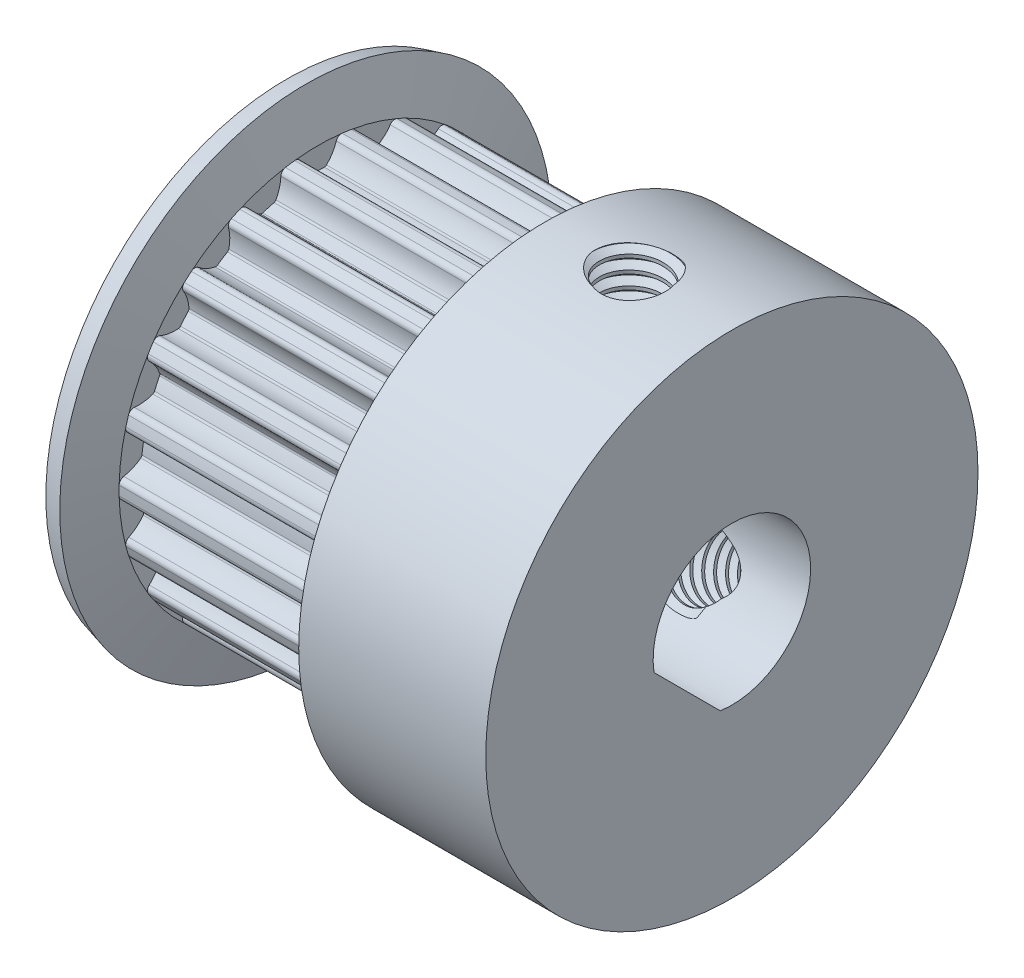
from build123d import *

# Parameters (mm, degrees)
BOSS_EXTRUDE4_DEPTH      = 11
SKETCH21_R               = 12.5
BOSS_EXTRUDE5_DEPTH      = 10
SKETCH22_R               = 8
BOSS_EXTRUDE6_DEPTH      = 1
F_8_0_8_DIAMETER_HOLE2_D = 8
SKETCH25_W               = 1.621
SKETCH25_H               = 13.418493926
SKETCH27_W               = 1.621
SKETCH27_H               = 8.843176378
CHAMFER2_SIZE            = 2
CHAMFER2_SIZE2           = 0.5
FILLET3_R                = 0.15
FILLET4_R                = 0.28
THREAD1_PITCH            = 0.7
THREAD2_PITCH            = 0.7
BOSS_EXTRUDE7_DEPTH      = 23


with BuildPart() as part:
    # Sketch12 → Revolve1 (revolve)
    with BuildSketch(Plane.XY, mode=Mode.PRIVATE) as revolve1_sk:
        Polygon((1, 9.993347502), (1, 0), (2, 0), (2, 10.125), (1.363620668, 12.5), (0.397694842, 12.241180955), align=None)
    revolve(revolve1_sk.sketch.rotate(Axis((0.397694842, 0, 0), (1, 0, 0)), 270), axis=Axis((0.397694842, 0, 0), (1, 0, 0)))

    # Sketch16 → Boss-Extrude4 (add)
    with BuildSketch(Plane(origin=(2, 0, 0), x_dir=(0, 0, -1), z_dir=(1, 0, 0))):
        with BuildLine():
            ThreePointArc((0.962989423, 10.07910097), (1.440937738, 10.021942099), (1.915629302, 9.942132034))
            ThreePointArc((1.915629302, 9.942132034), (1.956814924, 9.321945766), (2.188708301, 8.745271921))
            ThreePointArc((2.188708301, 8.745271921), (2.539819, 8.649829157), (2.88679237, 8.540295944))
            ThreePointArc((2.88679237, 8.540295944), (3.393646912, 8.900053828), (3.763592472, 9.399521089))
            ThreePointArc((3.763592472, 9.399521089), (4.206077007, 9.210023953), (4.639055134, 8.999710688))
            ThreePointArc((4.639055134, 8.999710688), (4.503845785, 8.393042991), (4.563878055, 7.774396575))
            ThreePointArc((4.563878055, 7.774396575), (4.873876969, 7.583900598), (5.175936407, 7.381050556))
            ThreePointArc((5.175936407, 7.381050556), (5.763615288, 7.583438292), (6.259291642, 7.958447911))
            ThreePointArc((6.259291642, 7.958447911), (6.630464931, 7.65196444), (6.986652308, 7.328186305))
            ThreePointArc((6.986652308, 7.328186305), (6.686001847, 6.784185789), (6.569309551, 6.173685854))
            ThreePointArc((6.569309551, 6.173685854), (6.813082413, 5.903569517), (7.04575686, 5.623836348))
            ThreePointArc((7.04575686, 5.623836348), (7.666649831, 5.652457685), (8.247900228, 5.872628613))
            ThreePointArc((8.247900228, 5.872628613), (8.51769202, 5.473988277), (8.768232464, 5.062975851))
            ThreePointArc((8.768232464, 5.062975851), (8.326497802, 4.625714201), (8.042534656, 4.072819822))
            ThreePointArc((8.042534656, 4.072819822), (8.200332438, 3.744966342), (8.344771995, 3.411012366))
            ThreePointArc((8.344771995, 3.411012366), (8.948578, 3.263548573), (9.568312991, 3.311043871))
            ThreePointArc((9.568312991, 3.311043871), (9.714866358, 2.852542138), (9.839462571, 2.387593203))
            ThreePointArc((9.839462571, 2.387593203), (9.292430425, 2.092494758), (8.864201435, 1.64199815))
            ThreePointArc((8.864201435, 1.64199815), (8.923240299, 1.282968267), (8.96774333, 0.921848447))
            ThreePointArc((8.96774333, 0.921848447), (9.505545599, 0.610246165), (10.113557939, 0.481218046))
            ThreePointArc((10.113557939, 0.481218046), (10.125, 0), (10.113557939, -0.481218046))
            ThreePointArc((10.113557939, -0.481218046), (9.505545599, -0.610246165), (8.96774333, -0.921848447))
            ThreePointArc((8.96774333, -0.921848447), (8.923240299, -1.282968267), (8.864201435, -1.64199815))
            ThreePointArc((8.864201435, -1.64199815), (9.292430425, -2.092494758), (9.839462571, -2.387593203))
            ThreePointArc((9.839462571, -2.387593203), (9.714866358, -2.852542138), (9.568312991, -3.311043871))
            ThreePointArc((9.568312991, -3.311043871), (8.948578, -3.263548573), (8.344771995, -3.411012366))
            ThreePointArc((8.344771995, -3.411012366), (8.200332438, -3.744966342), (8.042534656, -4.072819822))
            ThreePointArc((8.042534656, -4.072819822), (8.326497802, -4.625714201), (8.768232464, -5.062975851))
            ThreePointArc((8.768232464, -5.062975851), (8.51769202, -5.473988277), (8.247900228, -5.872628613))
            ThreePointArc((8.247900228, -5.872628613), (7.666649831, -5.652457685), (7.04575686, -5.623836348))
            ThreePointArc((7.04575686, -5.623836348), (6.813082413, -5.903569517), (6.569309551, -6.173685854))
            ThreePointArc((6.569309551, -6.173685854), (6.686001847, -6.784185789), (6.986652308, -7.328186305))
            ThreePointArc((6.986652308, -7.328186305), (6.630464931, -7.65196444), (6.259291642, -7.958447911))
            ThreePointArc((6.259291642, -7.958447911), (5.763615288, -7.583438292), (5.175936407, -7.381050556))
            ThreePointArc((5.175936407, -7.381050556), (4.873876969, -7.583900598), (4.563878055, -7.774396575))
            ThreePointArc((4.563878055, -7.774396575), (4.503845785, -8.393042991), (4.639055134, -8.999710688))
            ThreePointArc((4.639055134, -8.999710688), (4.206077007, -9.210023953), (3.763592472, -9.399521089))
            ThreePointArc((3.763592472, -9.399521089), (3.393646912, -8.900053828), (2.88679237, -8.540295944))
            ThreePointArc((2.88679237, -8.540295944), (2.539819, -8.649829157), (2.188708301, -8.745271921))
            ThreePointArc((2.188708301, -8.745271921), (1.956814924, -9.321945766), (1.915629302, -9.942132034))
            ThreePointArc((1.915629302, -9.942132034), (1.440937738, -10.021942099), (0.962989423, -10.07910097))
            ThreePointArc((0.962989423, -10.07910097), (0.748745446, -9.495639935), (0.363777582, -9.007657346))
            ThreePointArc((0.363777582, -9.007657346), (0, -9.015), (-0.363777582, -9.007657346))
            ThreePointArc((-0.363777582, -9.007657346), (-0.748745446, -9.495639935), (-0.962989423, -10.07910097))
            ThreePointArc((-0.962989423, -10.07910097), (-1.440937738, -10.021942099), (-1.915629302, -9.942132034))
            ThreePointArc((-1.915629302, -9.942132034), (-1.956814924, -9.321945766), (-2.188708301, -8.745271921))
            ThreePointArc((-2.188708301, -8.745271921), (-2.539819, -8.649829157), (-2.88679237, -8.540295944))
            ThreePointArc((-2.88679237, -8.540295944), (-3.393646912, -8.900053828), (-3.763592472, -9.399521089))
            ThreePointArc((-3.763592472, -9.399521089), (-4.206077007, -9.210023953), (-4.639055134, -8.999710688))
            ThreePointArc((-4.639055134, -8.999710688), (-4.503845785, -8.393042991), (-4.563878055, -7.774396575))
            ThreePointArc((-4.563878055, -7.774396575), (-4.873876969, -7.583900598), (-5.175936407, -7.381050556))
            ThreePointArc((-5.175936407, -7.381050556), (-5.763615288, -7.583438292), (-6.259291642, -7.958447911))
            ThreePointArc((-6.259291642, -7.958447911), (-6.630464931, -7.65196444), (-6.986652308, -7.328186305))
            ThreePointArc((-6.986652308, -7.328186305), (-6.686001847, -6.784185789), (-6.569309551, -6.173685854))
            ThreePointArc((-6.569309551, -6.173685854), (-6.813082413, -5.903569517), (-7.04575686, -5.623836348))
            ThreePointArc((-7.04575686, -5.623836348), (-7.666649831, -5.652457685), (-8.247900228, -5.872628613))
            ThreePointArc((-8.247900228, -5.872628613), (-8.51769202, -5.473988277), (-8.768232464, -5.062975851))
            ThreePointArc((-8.768232464, -5.062975851), (-8.326497802, -4.625714201), (-8.042534656, -4.072819822))
            ThreePointArc((-8.042534656, -4.072819822), (-8.200332438, -3.744966342), (-8.344771995, -3.411012366))
            ThreePointArc((-8.344771995, -3.411012366), (-8.948578, -3.263548573), (-9.568312991, -3.311043871))
            ThreePointArc((-9.568312991, -3.311043871), (-9.714866358, -2.852542138), (-9.839462571, -2.387593203))
            ThreePointArc((-9.839462571, -2.387593203), (-9.292430425, -2.092494758), (-8.864201435, -1.64199815))
            ThreePointArc((-8.864201435, -1.64199815), (-8.923240299, -1.282968267), (-8.96774333, -0.921848447))
            ThreePointArc((-8.96774333, -0.921848447), (-9.505545599, -0.610246165), (-10.113557939, -0.481218046))
            ThreePointArc((-10.113557939, -0.481218046), (-10.125, 0), (-10.113557939, 0.481218046))
            ThreePointArc((-10.113557939, 0.481218046), (-9.505545599, 0.610246165), (-8.96774333, 0.921848447))
            ThreePointArc((-8.96774333, 0.921848447), (-8.923240299, 1.282968267), (-8.864201435, 1.64199815))
            ThreePointArc((-8.864201435, 1.64199815), (-9.292430425, 2.092494758), (-9.839462571, 2.387593203))
            ThreePointArc((-9.839462571, 2.387593203), (-9.714866358, 2.852542138), (-9.568312991, 3.311043871))
            ThreePointArc((-9.568312991, 3.311043871), (-8.948578, 3.263548573), (-8.344771995, 3.411012366))
            ThreePointArc((-8.344771995, 3.411012366), (-8.200332438, 3.744966342), (-8.042534656, 4.072819822))
            ThreePointArc((-8.042534656, 4.072819822), (-8.326497802, 4.625714201), (-8.768232464, 5.062975851))
            ThreePointArc((-8.768232464, 5.062975851), (-8.51769202, 5.473988277), (-8.247900228, 5.872628613))
            ThreePointArc((-8.247900228, 5.872628613), (-7.666649831, 5.652457685), (-7.04575686, 5.623836348))
            ThreePointArc((-7.04575686, 5.623836348), (-6.813082413, 5.903569517), (-6.569309551, 6.173685854))
            ThreePointArc((-6.569309551, 6.173685854), (-6.686001847, 6.784185789), (-6.986652308, 7.328186305))
            ThreePointArc((-6.986652308, 7.328186305), (-6.630464931, 7.65196444), (-6.259291642, 7.958447911))
            ThreePointArc((-6.259291642, 7.958447911), (-5.763615288, 7.583438292), (-5.175936407, 7.381050556))
            ThreePointArc((-5.175936407, 7.381050556), (-4.873876969, 7.583900598), (-4.563878055, 7.774396575))
            ThreePointArc((-4.563878055, 7.774396575), (-4.503845785, 8.393042991), (-4.639055134, 8.999710688))
            ThreePointArc((-4.639055134, 8.999710688), (-4.206077007, 9.210023953), (-3.763592472, 9.399521089))
            ThreePointArc((-3.763592472, 9.399521089), (-3.393646912, 8.900053828), (-2.88679237, 8.540295944))
            ThreePointArc((-2.88679237, 8.540295944), (-2.539819, 8.649829157), (-2.188708301, 8.745271921))
            ThreePointArc((-2.188708301, 8.745271921), (-1.956814924, 9.321945766), (-1.915629302, 9.942132034))
            ThreePointArc((-1.915629302, 9.942132034), (-1.440937738, 10.021942099), (-0.962989423, 10.07910097))
            ThreePointArc((-0.962989423, 10.07910097), (-0.748745446, 9.495639935), (-0.363777582, 9.007657346))
            ThreePointArc((-0.363777582, 9.007657346), (0, 9.015), (0.363777582, 9.007657346))
            ThreePointArc((0.363777582, 9.007657346), (0.748745446, 9.495639935), (0.962989423, 10.07910097))
        make_face()
    extrude(amount=BOSS_EXTRUDE4_DEPTH)

    # Sketch21 → Boss-Extrude5 (add)
    with BuildSketch(Plane.ZY.offset(-13)):
        Circle(SKETCH21_R)
    extrude(amount=-BOSS_EXTRUDE5_DEPTH)

    # Sketch22 → Boss-Extrude6 (add)
    with BuildSketch(Plane.ZY.offset(-1)):
        Circle(SKETCH22_R)
    extrude(amount=BOSS_EXTRUDE6_DEPTH)

    # Ø8.0 (8) Diameter Hole2 (through all)
    with Locations(Plane(origin=(23, 0, 0), x_dir=(0, 0, -1), z_dir=(1, 0, 0))):
        with Locations((0, 0)):
            Hole(F_8_0_8_DIAMETER_HOLE2_D / 2)

    # Sketch25 → M3 Clearance Hole3 (revolve, cut)
    with BuildSketch(Plane(origin=(18, -1.828411811, -3.166902154), x_dir=(0, -0.8660254037844387, 0.4999999999999999), z_dir=(1, 0, 0))):
        with Locations((0.8105, 6.709246963)):
            Rectangle(SKETCH25_W, SKETCH25_H)
    revolve(axis=Axis((18, 1.346588189, 2.332359161), (0, -0.49999999999999994, -0.8660254037844388)), mode=Mode.SUBTRACT)

    # Sketch27 → M3 Clearance Hole4 (revolve, cut)
    with BuildSketch(Plane(origin=(18, 3.656823622, 0), x_dir=(0, 0, -1), z_dir=(1, 0, 0))):
        with Locations((0.8105, 4.421588189)):
            Rectangle(SKETCH27_W, SKETCH27_H)
    revolve(axis=Axis((18, -2.693176378, 0), (0, 1, 0)), mode=Mode.SUBTRACT)

    # Chamfer2
    chamfer2_edges = [part.edges().sort_by_distance(p)[0] for p in [
        (13, 0, -12.5),
    ]]
    chamfer2_side = [part.faces().sort_by_distance(p)[0] for p in [
        (13, 0, -12.146446609),
    ]]
    chamfer(chamfer2_edges, length=CHAMFER2_SIZE, length2=CHAMFER2_SIZE2, reference=chamfer2_side[0])

    # Fillet3
    fillet3_edges = [part.edges().sort_by_distance(p)[0] for p in [
        (7.5, 9.007657346, -0.363777582),
        (7.5, 9.007657346, 0.363777582),
        (7.5, 8.745271921, 2.188708301),
        (7.5, 8.540295944, 2.88679237),
        (7.5, 7.774396575, 4.563878055),
        (7.5, 7.381050556, 5.175936407),
        (7.5, 6.173685854, 6.569309551),
        (7.5, 5.623836348, 7.04575686),
        (7.5, 4.072819822, 8.042534656),
        (7.5, 3.411012366, 8.344771995),
        (7.5, 1.64199815, 8.864201435),
        (7.5, 0.921848447, 8.96774333),
        (7.5, -0.921848447, 8.96774333),
        (7.5, -1.64199815, 8.864201435),
        (7.5, -3.411012366, 8.344771995),
        (7.5, -4.072819822, 8.042534656),
        (7.5, -5.623836348, 7.04575686),
        (7.5, -6.173685854, 6.569309551),
        (7.5, -7.381050556, 5.175936407),
        (7.5, -7.774396575, 4.563878055),
        (7.5, -8.540295944, 2.88679237),
        (7.5, -8.745271921, 2.188708301),
        (7.5, -9.007657346, 0.363777582),
        (7.5, -9.007657346, -0.363777582),
        (7.5, -8.745271921, -2.188708301),
        (7.5, -8.540295944, -2.88679237),
        (7.5, -7.774396575, -4.563878055),
        (7.5, -7.381050556, -5.175936407),
        (7.5, -6.173685854, -6.569309551),
        (7.5, -5.623836348, -7.04575686),
        (7.5, -4.072819822, -8.042534656),
        (7.5, -3.411012366, -8.344771995),
        (7.5, -1.64199815, -8.864201435),
        (7.5, -0.921848447, -8.96774333),
        (7.5, 0.921848447, -8.96774333),
        (7.5, 1.64199815, -8.864201435),
        (7.5, 3.411012366, -8.344771995),
        (7.5, 4.072819822, -8.042534656),
        (7.5, 5.623836348, -7.04575686),
        (7.5, 6.173685854, -6.569309551),
        (7.5, 7.381050556, -5.175936407),
        (7.5, 7.774396575, -4.563878055),
        (7.5, 8.540295944, -2.88679237),
        (7.5, 8.745271921, -2.188708301),
    ]]
    fillet(fillet3_edges, radius=FILLET3_R)

    # Fillet4
    fillet4_edges = [part.edges().sort_by_distance(p)[0] for p in [
        (7.5, 10.07910097, -0.962989423),
        (7.5, 10.07910097, 0.962989423),
        (7.5, 9.942132034, 1.915629302),
        (7.5, 9.399521089, 3.763592472),
        (7.5, 8.999710688, 4.639055134),
        (7.5, 7.958447911, 6.259291642),
        (7.5, 7.328186305, 6.986652308),
        (7.5, 5.872628613, 8.247900228),
        (7.5, 5.062975851, 8.768232464),
        (7.5, 3.311043871, 9.568312991),
        (7.5, 2.387593203, 9.839462571),
        (7.5, 0.481218046, 10.113557939),
        (7.5, -0.481218046, 10.113557939),
        (7.5, -2.387593203, 9.839462571),
        (7.5, -3.311043871, 9.568312991),
        (7.5, -5.062975851, 8.768232464),
        (7.5, -5.872628613, 8.247900228),
        (7.5, -7.328186305, 6.986652308),
        (7.5, -7.958447911, 6.259291642),
        (7.5, -8.999710688, 4.639055134),
        (7.5, -9.399521089, 3.763592472),
        (7.5, -9.942132034, 1.915629302),
        (7.5, -10.07910097, 0.962989423),
        (7.5, -10.07910097, -0.962989423),
        (7.5, -9.942132034, -1.915629302),
        (7.5, -9.399521089, -3.763592472),
        (7.5, -8.999710688, -4.639055134),
        (7.5, -7.958447911, -6.259291642),
        (7.5, -7.328186305, -6.986652308),
        (7.5, -5.872628613, -8.247900228),
        (7.5, -5.062975851, -8.768232464),
        (7.5, -3.311043871, -9.568312991),
        (7.5, -2.387593203, -9.839462571),
        (7.5, -0.481218046, -10.113557939),
        (7.5, 0.481218046, -10.113557939),
        (7.5, 2.387593203, -9.839462571),
        (7.5, 3.311043871, -9.568312991),
        (7.5, 5.062975851, -8.768232464),
        (7.5, 5.872628613, -8.247900228),
        (7.5, 7.328186305, -6.986652308),
        (7.5, 7.958447911, -6.259291642),
        (7.5, 8.999710688, -4.639055134),
        (7.5, 9.399521089, -3.763592472),
        (7.5, 9.942132034, -1.915629302),
    ]]
    fillet(fillet4_edges, radius=FILLET4_R)

    # Thread1: the profile of Thread Profile1 profile screwed along a right-hand helix of 14.285714 turns, 6 arcs to a turn; built about Z, then put on its axis
    thread1_z = Axis((0, 0, 0), (0, 0, 1))
    thread1_corners = [(1.6207, 0, -0.000173205), (1.999886112, 0, 0.218749999), (1.999886112, 0, 0.306249999), (1.6207, 0, 0.525173203)]
    with BuildLine(mode=Mode.PRIVATE) as thread1_profile:
        Line(thread1_corners[0], thread1_corners[1])
        Line(thread1_corners[1], thread1_corners[2])
        Line(thread1_corners[2], thread1_corners[3])
        Line(thread1_corners[3], thread1_corners[0])
    thread1_cap = Face(thread1_profile.wire())
    thread1_turn_angles = [0, 30, 60, 90, 120, 150, 180, 210, 240, 270, 300, 330, 360]
    thread1_turn_weights = [1, 0.8660254037844387, 1, 0.8660254037844387, 1, 0.8660254037844387, 1, 0.8660254037844387, 1, 0.8660254037844387, 1, 0.8660254037844387, 1]
    thread1_turn_rails = [Edge.make_bspline([Vector(p[0], p[1], 0).rotate(thread1_z, thread1_turn_angles[k]) / thread1_turn_weights[k] + Vector(0, 0, p[2] + THREAD1_PITCH * thread1_turn_angles[k] / 360) for k in range(13)], [0, 0, 0, 1, 1, 2, 2, 3, 3, 4, 4, 5, 5, 6, 6, 6], 2, thread1_turn_weights) for p in thread1_corners]
    thread1_turn_sides = [Face.make_surface_from_curves(thread1_turn_rails[p[0]], thread1_turn_rails[p[1]]) for p in [(0, 1), (1, 2), (2, 3), (3, 0)]]
    thread1_last_angles = [5040, 5070, 5100, 5121.428571429, 5142.857142857]
    thread1_last_weights = [1, 0.8660254037844387, 1, 0.9308737486442035, 1]
    thread1_last_rails = [Edge.make_bspline([Vector(p[0], p[1], 0).rotate(thread1_z, thread1_last_angles[k]) / thread1_last_weights[k] + Vector(0, 0, p[2] + THREAD1_PITCH * thread1_last_angles[k] / 360) for k in range(5)], [0, 0, 0, 1, 1, 2, 2, 2], 2, thread1_last_weights) for p in thread1_corners]
    thread1_last_sides = [Face.make_surface_from_curves(thread1_last_rails[p[0]], thread1_last_rails[p[1]]) for p in [(0, 1), (1, 2), (2, 3), (3, 0)]]
    thread1 = Plane(origin=(18, 13.5, 0), x_dir=(-1, 0, 0), z_dir=(0, -1, 0)) * Solid(Shell([*[p.moved(Location((0, 0, THREAD1_PITCH * i))) for i in range(14) for p in thread1_turn_sides], *thread1_last_sides, thread1_cap, thread1_cap.rotate(thread1_z, 5142.857142857).moved(Location((0, 0, THREAD1_PITCH * 5142.857142857 / 360)))]))
    add(thread1, mode=Mode.SUBTRACT)

    # Thread2: the profile of Thread Profile2 profile screwed along a right-hand helix of 14.285714 turns, 6 arcs to a turn; built about Z, then put on its axis
    thread2_z = Axis((0, 0, 0), (0, 0, 1))
    thread2_corners = [(1.6207, 0, -0.000173205), (1.999886112, 0, 0.218749999), (1.999886112, 0, 0.306249999), (1.6207, 0, 0.525173203)]
    with BuildLine(mode=Mode.PRIVATE) as thread2_profile:
        Line(thread2_corners[0], thread2_corners[1])
        Line(thread2_corners[1], thread2_corners[2])
        Line(thread2_corners[2], thread2_corners[3])
        Line(thread2_corners[3], thread2_corners[0])
    thread2_cap = Face(thread2_profile.wire())
    thread2_turn_angles = [0, 30, 60, 90, 120, 150, 180, 210, 240, 270, 300, 330, 360]
    thread2_turn_weights = [1, 0.8660254037844387, 1, 0.8660254037844387, 1, 0.8660254037844387, 1, 0.8660254037844387, 1, 0.8660254037844387, 1, 0.8660254037844387, 1]
    thread2_turn_rails = [Edge.make_bspline([Vector(p[0], p[1], 0).rotate(thread2_z, thread2_turn_angles[k]) / thread2_turn_weights[k] + Vector(0, 0, p[2] + THREAD2_PITCH * thread2_turn_angles[k] / 360) for k in range(13)], [0, 0, 0, 1, 1, 2, 2, 3, 3, 4, 4, 5, 5, 6, 6, 6], 2, thread2_turn_weights) for p in thread2_corners]
    thread2_turn_sides = [Face.make_surface_from_curves(thread2_turn_rails[p[0]], thread2_turn_rails[p[1]]) for p in [(0, 1), (1, 2), (2, 3), (3, 0)]]
    thread2_last_angles = [5040, 5070, 5100, 5121.428571429, 5142.857142857]
    thread2_last_weights = [1, 0.8660254037844387, 1, 0.9308737486442035, 1]
    thread2_last_rails = [Edge.make_bspline([Vector(p[0], p[1], 0).rotate(thread2_z, thread2_last_angles[k]) / thread2_last_weights[k] + Vector(0, 0, p[2] + THREAD2_PITCH * thread2_last_angles[k] / 360) for k in range(5)], [0, 0, 0, 1, 1, 2, 2, 2], 2, thread2_last_weights) for p in thread2_corners]
    thread2_last_sides = [Face.make_surface_from_curves(thread2_last_rails[p[0]], thread2_last_rails[p[1]]) for p in [(0, 1), (1, 2), (2, 3), (3, 0)]]
    thread2 = Plane(origin=(18, -6.75, -11.691342951), x_dir=(1, 0, 0), z_dir=(0, 0.5, 0.866025404)) * Solid(Shell([*[p.moved(Location((0, 0, THREAD2_PITCH * i))) for i in range(14) for p in thread2_turn_sides], *thread2_last_sides, thread2_cap, thread2_cap.rotate(thread2_z, 5142.857142857).moved(Location((0, 0, THREAD2_PITCH * 5142.857142857 / 360)))]))
    add(thread2, mode=Mode.SUBTRACT)

    # Sketch35 → Boss-Extrude7 (add)
    with BuildSketch(Plane.ZY):
        with BuildLine():
            Line((3.956409641, -0.588916589), (0.588916589, -3.956409641))
            ThreePointArc((0.588916589, -3.956409641), (2.828427125, -2.828427125), (3.956409641, -0.588916589))
        make_face()
    extrude(amount=-BOSS_EXTRUDE7_DEPTH)


solid = part.part
